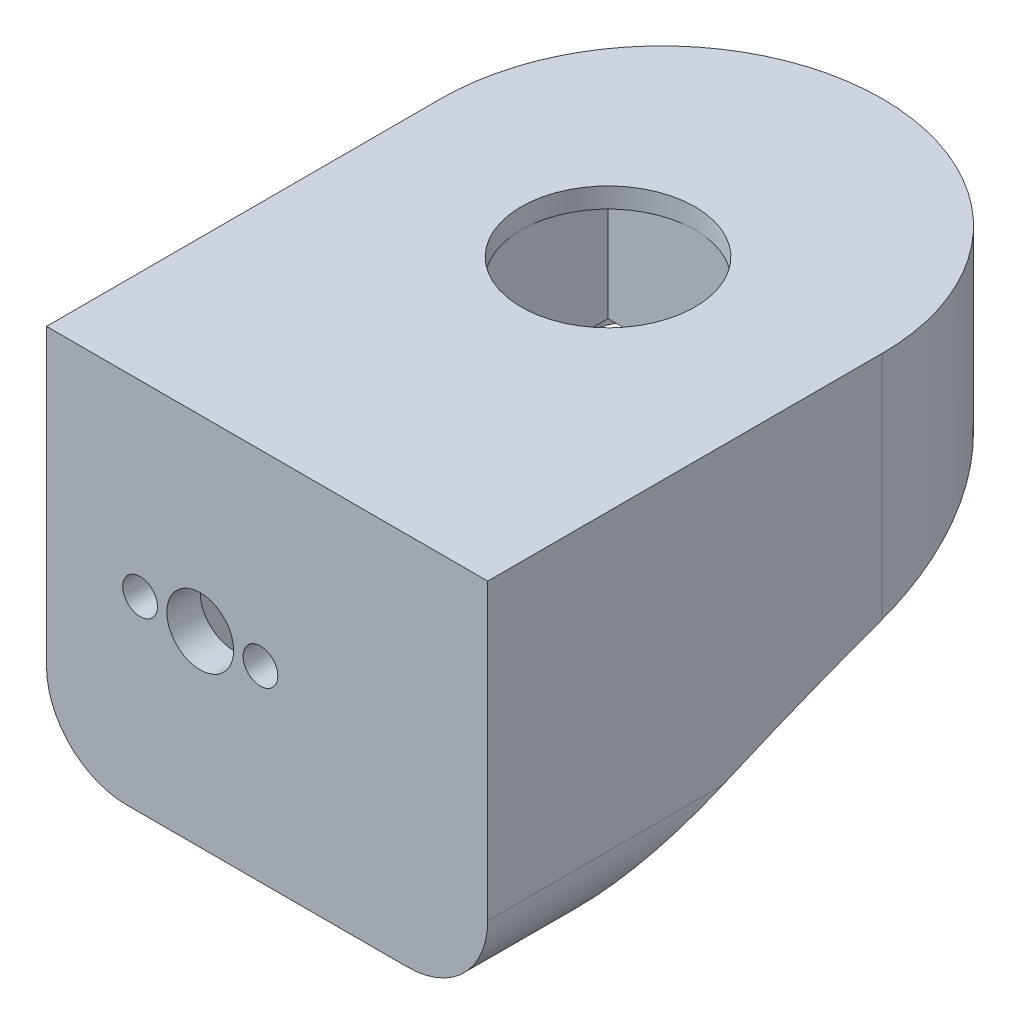
from build123d import *

# Parameters (mm, degrees)
SKETCH1_W           = 33
SKETCH1_H           = 28
BOSS_EXTRUDE1_DEPTH = 46
CUT_EXTRUDE1_DEPTH  = 59.318093247
CUT_EXTRUDE2_START  = -3
CUT_EXTRUDE2_DEPTH  = 27
FILLET1_R           = 12.5
FILLET2_R           = 16.5
FILLET3_R           = 6
SKETCH6_W           = 13
SKETCH6_H           = 23
CUT_EXTRUDE3_DEPTH  = 9
SKETCH8_R           = 6.5
CUT_EXTRUDE4_DEPTH  = 9
SKETCH9_R           = 1
CUT_EXTRUDE5_DEPTH  = 8
SKETCH10_R          = 1.3
SKETCH10_R_2        = 2.5
CUT_EXTRUDE6_DEPTH  = 2.5


with BuildPart() as part:
    # Sketch1 → Boss-Extrude1 (new body)
    with BuildSketch(Plane.XY):
        Rectangle(SKETCH1_W, SKETCH1_H)
    extrude(amount=BOSS_EXTRUDE1_DEPTH)

    # Sketch3 → Cut-Extrude1 (cut, through all)
    with BuildSketch(Plane.ZY.offset(16.5)):
        with BuildLine():
            Line((0, 2), (0, -14))
            Line((0, -14), (41, -14))
            add(Edge.make_bspline(
                [(41, -14), (21.241610725, -3.748388801), (0, 2)],
                knots=[0, 0, 0, 1, 1, 1], degree=2))
        make_face()
    extrude(amount=-CUT_EXTRUDE1_DEPTH, mode=Mode.SUBTRACT)

    # Sketch4 → Cut-Extrude2 (cut)
    with BuildSketch(Plane.ZY.offset(16.5).offset(CUT_EXTRUDE2_START)):
        with BuildLine():
            Line((41, -14), (43.5, -14))
            Line((43.5, -14), (43.5, 3.5))
            Line((43.5, 3.5), (5.5, 3.5))
            Line((5.5, 3.5), (5.5, 0.428638096))
            add(Edge.make_bspline(
                [(41, -14), (23.811256263, -5.081645607), (5.5, 0.428638096)],
                knots=[0, 0, 0, 1, 1, 1], degree=2))
        make_face()
    extrude(amount=-CUT_EXTRUDE2_DEPTH, mode=Mode.SUBTRACT)

    # Fillet1
    fillet1_edges = [part.edges().sort_by_distance(p)[0] for p in [
        (-13.5, 1.964319048, 5.5),
        (13.5, 1.964319048, 5.5),
    ]]
    fillet(fillet1_edges, radius=FILLET1_R)

    # Fillet2
    fillet2_edges = [part.edges().sort_by_distance(p)[0] for p in [
        (-16.5, 8, 0),
        (16.5, 8, 0),
    ]]
    fillet(fillet2_edges, radius=FILLET2_R - 0.0001)  # a hair under: the kernel refuses the full size

    # Fillet3
    fillet3_edges = [part.edges().sort_by_distance(p)[0] for p in [
        (16.5, -14, 43.5),
        (-16.5, -14, 43.5),
    ]]
    fillet(fillet3_edges, radius=FILLET3_R)

    # Sketch6 → Cut-Extrude3 (cut)
    with BuildSketch(Plane.XZ.offset(-3.5)):
        with Locations((0, 25.5)):
            Rectangle(SKETCH6_W, SKETCH6_H)
    extrude(amount=-CUT_EXTRUDE3_DEPTH, mode=Mode.SUBTRACT)

    # Sketch8 → Cut-Extrude4 (cut)
    with BuildSketch(Plane.XZ.offset(-12.5)):
        with Locations(Location((0, 20.5, 0), (0, 0, 270))):
            Circle(SKETCH8_R)
    extrude(amount=-CUT_EXTRUDE4_DEPTH, mode=Mode.SUBTRACT)

    # Sketch9 → Cut-Extrude5 (cut)
    with BuildSketch(Plane.XZ.offset(-3.5)):
        with Locations(Location((0, 39.3, 0), (0, 0, 270))):
            Circle(SKETCH9_R)
        with Locations(Location((0, 11.7, 0), (0, 0, 270))):
            Circle(SKETCH9_R)
    extrude(amount=-CUT_EXTRUDE5_DEPTH, mode=Mode.SUBTRACT)

    # Sketch10 → Cut-Extrude6 (cut)
    with BuildSketch(Plane.XY.offset(46)):
        with Locations((-9.5, 0)):
            Circle(SKETCH10_R)
        with Locations((-5, 0)):
            Circle(SKETCH10_R_2)
        with Locations((-0.5, 0)):
            Circle(SKETCH10_R)
    extrude(amount=-CUT_EXTRUDE6_DEPTH, mode=Mode.SUBTRACT)


solid = part.part
